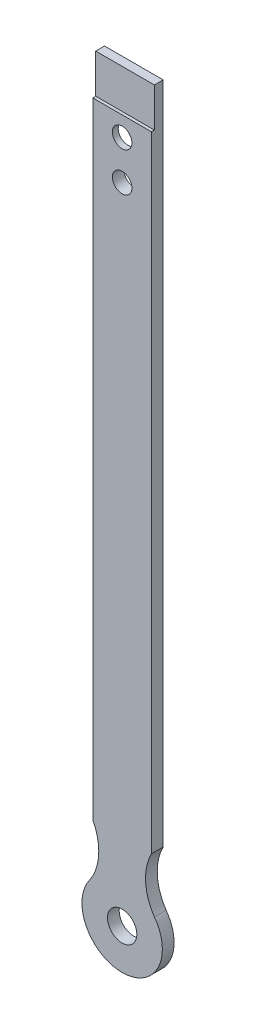
from build123d import *

# Parameters (mm, degrees)
SKETCH_1_R          = 5
SKETCH_1_R_2        = 7.5
EXTRUDE_1_DEPTH     = 6
SKETCH_2_W          = 1.5
SKETCH_2_H          = 20
CUT_EXTRUDE_1_DEPTH = 402.62399074
CHAMFER_1_SIZE      = 3
CHAMFER_1_SIZE2     = 5.196152423


with BuildPart() as part:
    # Эскиз1 → Бобышка-Вытянуть1 (new body)
    with BuildSketch(Plane.XY):
        with BuildLine():
            Line((15, 60.126164395), (15, 400))
            Line((15, 400), (-15, 400))
            Line((-15, 400), (-15, 60.126164395))
            ThreePointArc((-15, 60.126164395), (-11.99467632, 46.284317121), (-16.512069377, 32.859643332))
            ThreePointArc((-16.512069377, 32.859643332), (0, 0), (16.512069377, 32.859643332))
            ThreePointArc((16.512069377, 32.859643332), (11.99467632, 46.284317121), (15, 60.126164395))
        make_face()
        with Locations((0, 370)):
            Circle(SKETCH_1_R, mode=Mode.SUBTRACT)
        with Locations((0, 350)):
            Circle(SKETCH_1_R, mode=Mode.SUBTRACT)
        with Locations((0, 20.578503871)):
            Circle(SKETCH_1_R_2, mode=Mode.SUBTRACT)
    extrude(amount=EXTRUDE_1_DEPTH)

    # Эскиз2 → Вырез-Вытянуть1 (cut, through all)
    with BuildSketch(Plane.ZY.offset(15)):
        with Locations((5.25, 390)):
            Rectangle(SKETCH_2_W, SKETCH_2_H)
    extrude(amount=-CUT_EXTRUDE_1_DEPTH, mode=Mode.SUBTRACT)

    # Фаска1
    chamfer_1_edges = [part.edges().sort_by_distance(p)[0] for p in [
        (-5, 370, 0),
    ]]
    chamfer_1_side = [part.faces().sort_by_distance(p)[0] for p in [
        (-5, 370, 3),
    ]]
    chamfer(chamfer_1_edges, length=CHAMFER_1_SIZE, length2=CHAMFER_1_SIZE2, reference=chamfer_1_side[0])


solid = part.part
